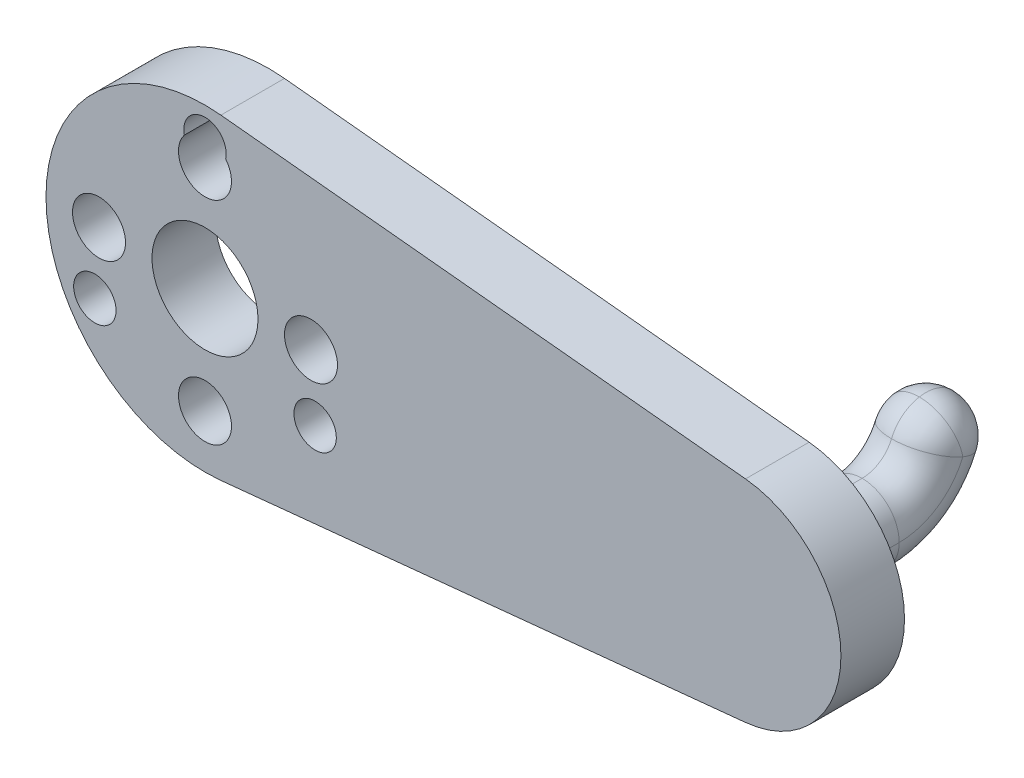
from build123d import *

# Parameters (mm, degrees)
SKETCH_1_R      = 1.25
SKETCH_1_R_2    = 2.5
SKETCH_1_R_3    = 1
EXTRUDE_1_DEPTH = 3
EXTRUDE_2_DEPTH = 1.75
FILLET_1_R      = 1.75


with BuildPart() as part:
    # 草图1 → 凸台-拉伸1 (new body)
    with BuildSketch(Plane.XY):
        with BuildLine():
            Line((0.75, 7.462405778), (25.5, 4.974937186))
            ThreePointArc((25.5, 4.974937186), (30, 0), (25.5, -4.974937186))
            Line((25.5, -4.974937186), (0.75, -7.462405778))
            ThreePointArc((0.75, -7.462405778), (-7.5, 0), (0.75, 7.462405778))
        make_face()
        with Locations((5, 0)):
            Circle(SKETCH_1_R, mode=Mode.SUBTRACT)
        with Locations((0, -5)):
            Circle(SKETCH_1_R, mode=Mode.SUBTRACT)
        with Locations((-5, 0)):
            Circle(SKETCH_1_R, mode=Mode.SUBTRACT)
        Circle(SKETCH_1_R_2, mode=Mode.SUBTRACT)
        with Locations((5.196152423, -3)):
            Circle(SKETCH_1_R_3, mode=Mode.SUBTRACT)
        with Locations((-5.196152423, -3)):
            Circle(SKETCH_1_R_3, mode=Mode.SUBTRACT)
        with BuildLine():
            ThreePointArc((-0.975780937, 5.78125), (0, 3.75), (0.975780937, 5.78125))
            ThreePointArc((0.975780937, 5.78125), (0, 7), (-0.975780937, 5.78125))
        make_face(mode=Mode.SUBTRACT)
    extrude(amount=EXTRUDE_1_DEPTH)

    # 草图2 → 凸台-拉伸2 (add, symmetric)
    with BuildSketch(Plane(origin=(25, 0, 0), x_dir=(0, 0, -1), z_dir=(1, 0, 0))):
        with BuildLine():
            Line((3, -1.75), (0, -1.75))
            Line((0, -1.75), (0, 1.75))
            Line((0, 1.75), (3, 1.75))
            ThreePointArc((3, 1.75), (4.149066665, 2.285818585), (4.47721163, 3.510472267))
            Line((4.47721163, 3.510472267), (7.924038765, 4.118240888))
            ThreePointArc((7.924038765, 4.118240888), (6.830222216, 0.036061952), (3, -1.75))
        make_face()
    extrude(amount=EXTRUDE_2_DEPTH, both=True)

    # 圆角1
    fillet_1_edges = [part.edges().sort_by_distance(p)[0] for p in [
        (23.25, 0, 0),
        (25, 1.75, 0),
        (23.25, -1.75, -1.5),
        (25, -1.75, 0),
        (23.25, 0.036061952, -6.830222216),
        (25, -1.75, -3),
        (23.25, 3.814356577, -6.200625197),
        (25, 4.118240888, -7.924038765),
        (23.25, 2.285818585, -4.149066665),
        (25, 3.510472267, -4.47721163),
        (23.25, 1.75, -1.5),
        (25, 1.75, -3),
        (26.75, 0, 0),
        (26.75, -1.75, -1.5),
        (26.75, 0.036061952, -6.830222216),
        (26.75, 3.814356577, -6.200625197),
        (26.75, 2.285818585, -4.149066665),
        (26.75, 1.75, -1.5),
    ]]
    fillet(fillet_1_edges, radius=FILLET_1_R - 0.0001)  # a hair under: the kernel refuses the full size


solid = part.part
